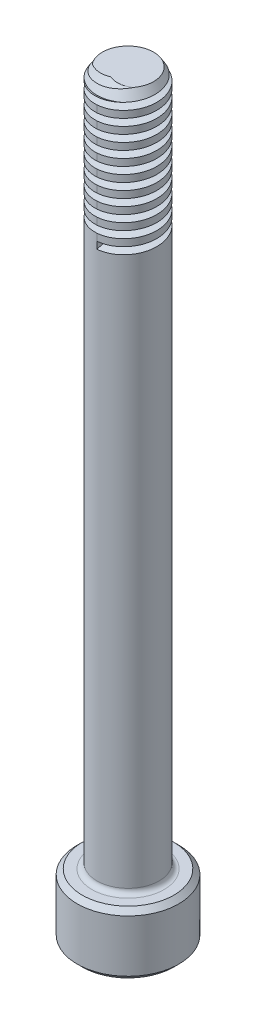
from build123d import *

# Parameters (mm, degrees)
CUT_SWEEP1_PITCH   = 0.635
CUT_EXTRUDE1_DEPTH = 1.2954
FILLET1_R          = 0.2286
FILLET2_R          = 0.396875794
CHAMFER2_SIZE      = 0.2286
CHAMFER3_SIZE      = 0.127


with BuildPart() as part:
    # Sketch1 → Revolve1 (revolve)
    with BuildSketch(Plane.XY, mode=Mode.PRIVATE) as revolve1_sk:
        Polygon((0, 0), (0, 34.5948), (1.4224, 34.5948), (1.4224, 2.8448), (2.3241, 2.8448), (2.3241, 0), align=None)
    revolve(revolve1_sk.sketch.rotate(Axis((0, 0, 0), (0, 1, 0)), 90), axis=Axis((0, 0, 0), (0, 1, 0)))

    # Cut-Sweep1: arcs per turn and ends read off the stored shape
    # Cut-Sweep1: the profile of Sketch3 profile screwed along a right-hand helix through 11 turns, 6 arcs to a turn; built about Z, then put on its axis
    cut_sweep1_z = Axis((0, 0, 0), (0, 0, 1))
    cut_sweep1_corners = [(1.4227, 0, -0.476175), (1.4227, 0, -0.793825), (0.78739873, 0, -0.635)]
    with BuildLine(mode=Mode.PRIVATE) as cut_sweep1_profile:
        Line(cut_sweep1_corners[0], cut_sweep1_corners[1])
        Line(cut_sweep1_corners[1], cut_sweep1_corners[2])
        Line(cut_sweep1_corners[2], cut_sweep1_corners[0])
    cut_sweep1_cap = Face(cut_sweep1_profile.wire())
    cut_sweep1_turn_angles = [0, 30, 60, 90, 120, 150, 180, 210, 240, 270, 300, 330, 360]
    cut_sweep1_turn_weights = [1, 0.8660254037844387, 1, 0.8660254037844387, 1, 0.8660254037844387, 1, 0.8660254037844387, 1, 0.8660254037844387, 1, 0.8660254037844387, 1]
    cut_sweep1_turn_rails = [Edge.make_bspline([Vector(p[0], p[1], 0).rotate(cut_sweep1_z, cut_sweep1_turn_angles[k]) / cut_sweep1_turn_weights[k] + Vector(0, 0, p[2] + CUT_SWEEP1_PITCH * cut_sweep1_turn_angles[k] / 360) for k in range(13)], [0, 0, 0, 1, 1, 2, 2, 3, 3, 4, 4, 5, 5, 6, 6, 6], 2, cut_sweep1_turn_weights) for p in cut_sweep1_corners]
    cut_sweep1_turn_sides = [Face.make_surface_from_curves(cut_sweep1_turn_rails[p[0]], cut_sweep1_turn_rails[p[1]]) for p in [(0, 1), (1, 2), (2, 0)]]
    cut_sweep1 = Plane(origin=(0, 34.5948, 0), x_dir=(0, 0, 1), z_dir=(0, -1, 0)) * Solid(Shell([*[p.moved(Location((0, 0, CUT_SWEEP1_PITCH * i))) for i in range(11) for p in cut_sweep1_turn_sides], cut_sweep1_cap, cut_sweep1_cap.rotate(cut_sweep1_z, 3960).moved(Location((0, 0, CUT_SWEEP1_PITCH * 3960 / 360)))]))
    add(cut_sweep1, mode=Mode.SUBTRACT)

    # Sketch4 → Cut-Extrude1 (cut)
    with BuildSketch(Plane(origin=(0, 0, 0), x_dir=(1, 0, 0), z_dir=(0, 1, 0))):
        Polygon((0, 1.378481503), (-1.1938, 0.689240751), (-1.1938, -0.689240751), (0, -1.378481503), (1.1938, -0.689240751), (1.1938, 0.689240751), align=None)
    extrude(amount=CUT_EXTRUDE1_DEPTH, mode=Mode.SUBTRACT)

    # Fillet1
    fillet1_edges = [part.edges().sort_by_distance(p)[0] for p in [
        (0, 2.8448, 1.4224),
    ]]
    fillet(fillet1_edges, radius=FILLET1_R)

    # Fillet2
    fillet2_edges = [part.edges().sort_by_distance(p)[0] for p in [
        (1.1938, 0.6477, -0.689240751),
        (0, 0.6477, -1.378481503),
        (-1.1938, 0.6477, -0.689240751),
        (-1.1938, 0.6477, 0.689240751),
        (0, 0.6477, 1.378481503),
        (1.1938, 0.6477, 0.689240751),
        (0.5969, 1.2954, -1.033861127),
        (-0.5969, 1.2954, -1.033861127),
        (-1.1938, 1.2954, 0),
        (-0.5969, 1.2954, 1.033861127),
        (0.5969, 1.2954, 1.033861127),
        (1.1938, 1.2954, 0),
    ]]
    fillet(fillet2_edges, radius=FILLET2_R)

    # Chamfer1: read off the stored shape, not the designer's step
    # Chamfer1 outline → Chamfer1 (revolve, cut)
    with BuildSketch(Plane.XY):
        Polygon((1.4224, 34.5948), (1.168399492, 34.5948), (1.4224, 34.183376279), align=None)
    revolve(axis=Axis((0, 0, 0), (0, 1, 0)), mode=Mode.SUBTRACT)

    # Chamfer2
    chamfer2_edges = [part.edges().sort_by_distance(p)[0] for p in [
        (0, 0, 2.3241),
        (0, 2.8448, 2.3241),
    ]]
    chamfer(chamfer2_edges, length=CHAMFER2_SIZE)

    # Chamfer3
    chamfer3_edges = [part.edges().sort_by_distance(p)[0] for p in [
        (0.5969, 0, -1.033861127),
        (-0.5969, 0, -1.033861127),
        (-1.1938, 0, 0),
        (-0.5969, 0, 1.033861127),
        (0.5969, 0, 1.033861127),
        (1.1938, 0, 0),
        (0, 0, -1.317084604),
        (1.140628726, 0, -0.658542302),
        (1.140628726, 0, 0.658542302),
        (0, 0, 1.317084604),
        (-1.140628726, 0, 0.658542302),
        (-1.140628726, 0, -0.658542302),
    ]]
    chamfer(chamfer3_edges, length=CHAMFER3_SIZE)


solid = part.part
